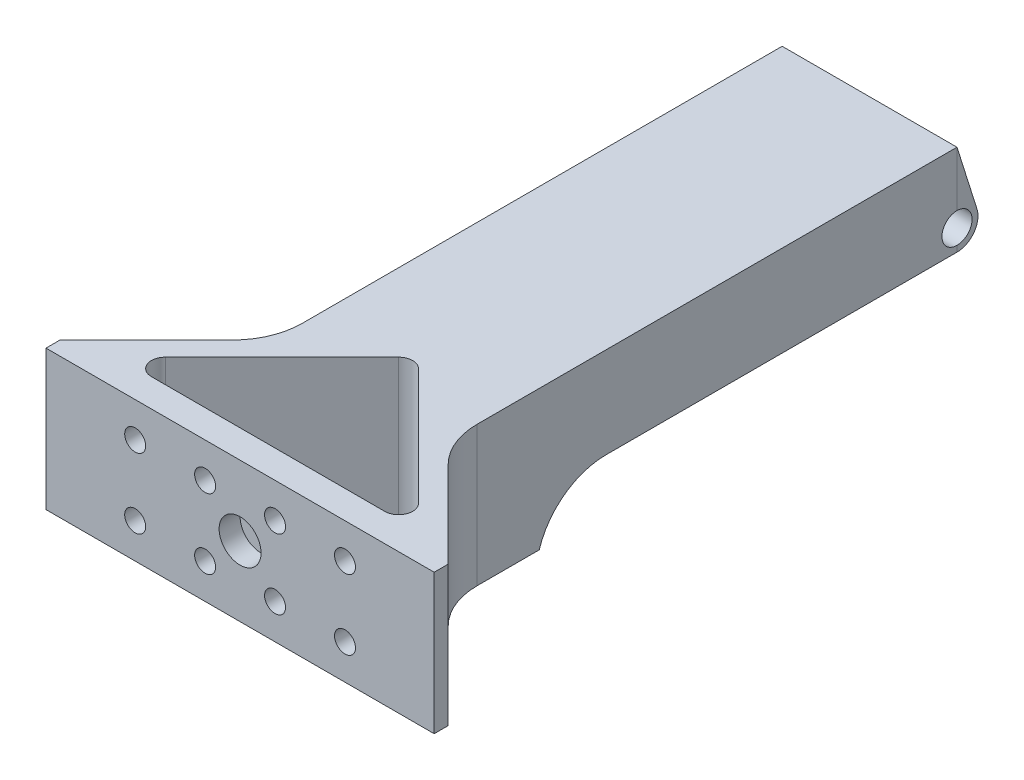
from build123d import *

# Parameters (mm, degrees)
EXTRUDE_1_DEPTH     = 20
SKETCH_2_R          = 1.5
CUT_EXTRUDE_1_DEPTH = 5
SKETCH_3_R          = 3
CUT_EXTRUDE_2_DEPTH = 3
SKETCH_4_W          = 24.99770673
SKETCH_4_H          = 59.73
CUT_EXTRUDE_3_DEPTH = 7
EXTRUDE_2_DEPTH     = 25
SKETCH_6_R          = 2.15
CUT_EXTRUDE_4_DEPTH = 104.292213424
FILLET_4_R          = 10
FILLET_5_R          = 10


with BuildPart() as part:
    # 스케치1 → 보스-돌출1 (new body)
    with BuildSketch(Plane(origin=(0, 0, 0), x_dir=(1, 0, 0), z_dir=(0, 1, 0))):
        Polygon((40.24770673, 90), (15.25229327, 90), (15.25229327, 17.25229327), (0, 2), (0, 0), (55.5, 0), (55.5, 2), (40.24770673, 17.25229327), align=None)
        with BuildLine():
            Line((11.071067812, 4), (44.428932188, 4))
            ThreePointArc((44.428932188, 4), (46.276691253, 5.234633135), (45.843145751, 7.414213562))
            Line((45.843145751, 7.414213562), (29.164213562, 24.093145751))
            ThreePointArc((29.164213562, 24.093145751), (27.75, 24.678932188), (26.335786438, 24.093145751))
            Line((26.335786438, 24.093145751), (9.656854249, 7.414213562))
            ThreePointArc((9.656854249, 7.414213562), (9.223308747, 5.234633135), (11.071067812, 4))
        make_face(mode=Mode.SUBTRACT)
    extrude(amount=EXTRUDE_1_DEPTH)

    # 스케치2 → 컷-돌출1 (cut)
    with BuildSketch(Plane.XY):
        with Locations((12.75, 15)):
            Circle(SKETCH_2_R)
        with Locations((22.75, 15)):
            Circle(SKETCH_2_R)
        with Locations(Location((32.75, 15, 0), (0, 0, 180))):
            Circle(SKETCH_2_R)
        with Locations(Location((42.75, 15, 0), (0, 0, 180))):
            Circle(SKETCH_2_R)
        with Locations((42.75, 5)):
            Circle(SKETCH_2_R)
        with Locations((32.75, 5)):
            Circle(SKETCH_2_R)
        with Locations(Location((22.75, 5, 0), (0, 0, 180))):
            Circle(SKETCH_2_R)
        with Locations(Location((12.75, 5, 0), (0, 0, 180))):
            Circle(SKETCH_2_R)
    extrude(amount=-CUT_EXTRUDE_1_DEPTH, mode=Mode.SUBTRACT)

    # 스케치3 → 컷-돌출2 (cut)
    with BuildSketch(Plane.XY):
        with Locations((27.75, 10)):
            Circle(SKETCH_3_R)
    extrude(amount=-CUT_EXTRUDE_2_DEPTH, mode=Mode.SUBTRACT)

    # 스케치4 → 컷-돌출3 (cut)
    with BuildSketch(Plane.XZ):
        with Locations((27.748853365, -60.135)):
            Rectangle(SKETCH_4_W, SKETCH_4_H)
    extrude(amount=-CUT_EXTRUDE_3_DEPTH, mode=Mode.SUBTRACT)

    # 스케치5 → 보스-돌출2 (add)
    with BuildSketch(Plane.ZY.offset(-15.25229327)):
        with BuildLine():
            Line((-90, 20), (-92.892384696, 10.804147089))
            ThreePointArc((-92.892384696, 10.804147089), (-92.390282771, 8.184258847), (-90, 7))
            Line((-90, 7), (-90, 20))
        make_face()
    extrude(amount=-EXTRUDE_2_DEPTH)

    # 스케치6 → 컷-돌출4 (cut, through all)
    with BuildSketch(Plane.ZY.offset(-15.25229327)):
        with Locations((-90.002169099, 9.999999216)):
            Circle(SKETCH_6_R)
    extrude(amount=-CUT_EXTRUDE_4_DEPTH, mode=Mode.SUBTRACT)

    # 필렛4
    fillet_4_edges = [part.edges().sort_by_distance(p)[0] for p in [
        (15.25229327, 10, -17.25229327),
        (40.24770673, 10, -17.25229327),
    ]]
    fillet(fillet_4_edges, radius=FILLET_4_R)

    # 필렛5
    # the kernel refuses this fillet: 10 mm, written as the material it adds along each edge
    with BuildSketch(Plane(origin=(15.25229327, 7, -30.27), x_dir=(0, -1, 0), z_dir=(1, 0, 0))) as fillet_5_piece_1:
        with BuildLine():
            CenterArc((10, 9.539392014), FILLET_5_R, 180, 72.542396876)
            Line((0, 9.539392014), (-0.2, 9.539392014))
            Line((-0.2, 9.539392014), (-0.2, 0))
            Line((-0.2, 0), (0, -0.2))
            ThreePointArc((0, -0.2), (3.5, -0.2), (6.94, -0.19078784))
            Line((6.94, -0.19078784), (7, 0))
        make_face()
    extrude(amount=24.99541346)


solid = part.part
